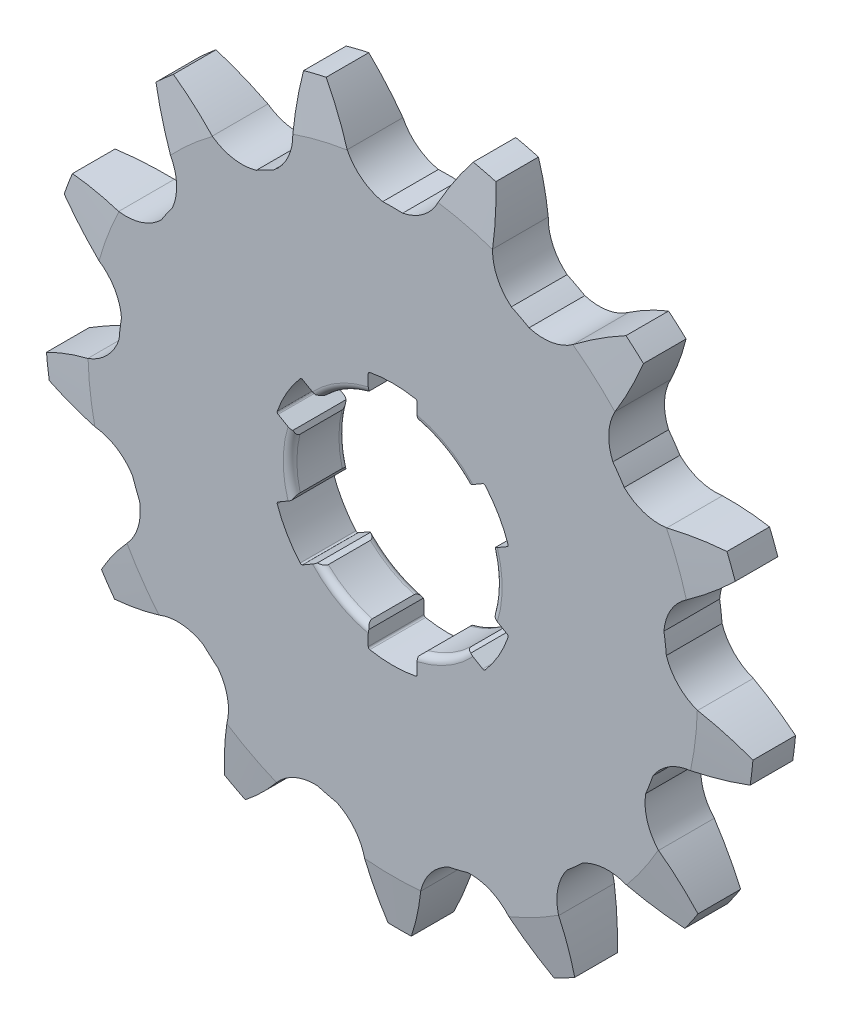
from build123d import *

# Parameters (mm, degrees)
DODANIE_WYCI_GNI_CIE1_DEPTH = 5.7
SZYK_KO_OWY1_COUNT          = 13
SZKIC4_OUTSIDE_W            = 602.69
SZKIC4_OUTSIDE_H            = 602.183
SZKIC4_OUTSIDE_R            = 31.1675
WYTNIJ_WYCI_GNI_CIE4_DEPTH  = 35.7
WYTNIJ_WYCI_GNI_CIE4_DRAFT  = -82
SZKIC5_OUTSIDE_W            = 513.272
SZKIC5_OUTSIDE_H            = 512.765
SZKIC5_OUTSIDE_R            = 31.1675
WYTNIJ_WYCI_GNI_CIE5_DEPTH  = 25.7
WYTNIJ_WYCI_GNI_CIE5_DRAFT  = -83
SZKIC10_R                   = 10.5
WYTNIJ_WYCI_GNI_CIE6_DEPTH  = 52.508093114
ZAOKR_GLENIE1_R             = 0.2
SFAZOWANIE1_SIZE            = 0.40919512
SFAZOWANIE1_SIZE_2          = 0.3
ZAOKR_GLENIE3_R             = 0.7


with BuildPart() as part:
    # Szkic1 → Dodanie-wyciągnięcie1 (new body)
    with BuildSketch(Plane.XY):
        with BuildLine():
            ThreePointArc((8.679500512, 35.214117834), (8.098931775, 35.352158748), (7.516170377, 35.480628614))
            ThreePointArc((7.516170377, 35.480628614), (5.979553034, 33.229042861), (4.65365868, 30.847271372))
            ThreePointArc((4.65365868, 30.847271372), (0, 27.9675), (-4.65365868, 30.847271372))
            ThreePointArc((-4.65365868, 30.847271372), (-5.979553034, 33.229042861), (-7.516170377, 35.480628614))
            ThreePointArc((-7.516170377, 35.480628614), (-8.098931775, 35.352158748), (-8.679500512, 35.214117834))
            Line((-8.679500512, 35.214117834), (-6.721778721, 27.271328297))
            ThreePointArc((-6.721778721, 27.271328297), (0, -28.0875), (6.721778721, 27.271328297))
            Line((6.721778721, 27.271328297), (8.679500512, 35.214117834))
        make_face()
    dodanie_wyci_gni_cie1 = extrude(amount=DODANIE_WYCI_GNI_CIE1_DEPTH)

    # Szyk kołowy1: Dodanie-wyciągnięcie1 ×13 about axis
    szyk_ko_owy1_axis = Axis((0, 0, 0), (0, 0, 1))
    for i in range(1, SZYK_KO_OWY1_COUNT):
        add(dodanie_wyci_gni_cie1.rotate(szyk_ko_owy1_axis, i * 360 / SZYK_KO_OWY1_COUNT))


with BuildPart() as wytnij_wyci_gni_cie4_tool:
    # Szkic4 outside → Wytnij-wyciągnięcie4 (with draft: the straight prism first)
    with BuildSketch(Plane.XY.offset(5.7)):
        with Locations((0, -0.3935)):
            Rectangle(SZKIC4_OUTSIDE_W, SZKIC4_OUTSIDE_H)
        Circle(SZKIC4_OUTSIDE_R, mode=Mode.SUBTRACT)
    extrude(amount=-WYTNIJ_WYCI_GNI_CIE4_DEPTH)
    # Wytnij-wyciągnięcie4: the draft: its side faces are tilted about the plane it starts from
    wytnij_wyci_gni_cie4_sides = [wytnij_wyci_gni_cie4_tool.faces().sort_by_distance(p)[0] for p in [
        (0, -301.485, -12.15),
        (301.345, -0.3935, -12.15),
        (0, 300.698, -12.15),
        (-301.345, -0.3935, -12.15),
        (-31.1675, 0, -12.15),
    ]]
    draft(wytnij_wyci_gni_cie4_sides, Plane.XY.offset(5.7), WYTNIJ_WYCI_GNI_CIE4_DRAFT)


with BuildPart() as part_1:
    add(part.part)

    # Wytnij-wyciągnięcie4: cut by wytnij_wyci_gni_cie4_tool
    add(wytnij_wyci_gni_cie4_tool.part, mode=Mode.SUBTRACT)


with BuildPart() as wytnij_wyci_gni_cie5_tool:
    # Szkic5 outside → Wytnij-wyciągnięcie5 (with draft: the straight prism first)
    with BuildSketch(Plane(origin=(0, 0, 0), x_dir=(-1, 0, 0), z_dir=(0, 0, -1))):
        with Locations((0, -0.3935)):
            Rectangle(SZKIC5_OUTSIDE_W, SZKIC5_OUTSIDE_H)
        Circle(SZKIC5_OUTSIDE_R, mode=Mode.SUBTRACT)
    extrude(amount=-WYTNIJ_WYCI_GNI_CIE5_DEPTH)
    # Wytnij-wyciągnięcie5: the draft: its side faces are tilted about the plane it starts from
    wytnij_wyci_gni_cie5_sides = [wytnij_wyci_gni_cie5_tool.faces().sort_by_distance(p)[0] for p in [
        (0, -256.776, 12.85),
        (-256.636, -0.3935, 12.85),
        (0, 255.989, 12.85),
        (256.636, -0.3935, 12.85),
        (31.1675, 0, 12.85),
    ]]
    draft(wytnij_wyci_gni_cie5_sides, Plane(origin=(0, 0, 0), x_dir=(-1, 0, 0), z_dir=(0, 0, -1)), WYTNIJ_WYCI_GNI_CIE5_DRAFT)


with BuildPart() as part_2:
    add(part_1.part)

    # Wytnij-wyciągnięcie5: cut by wytnij_wyci_gni_cie5_tool
    add(wytnij_wyci_gni_cie5_tool.part, mode=Mode.SUBTRACT)

    # Szkic10 → Wytnij-wyciągnięcie6 (cut, through all)
    with BuildSketch(Plane.XY.offset(5.7)):
        Circle(SZKIC10_R)
        with BuildLine():
            Line((-7.581760866, 7.264083023), (-9.356601718, 8.288787866))
            ThreePointArc((-9.356601718, 8.288787866), (-10.825317547, 6.25), (-11.856601718, 3.958660847))
            Line((-11.856601718, 3.958660847), (-10.081760866, 2.933956004))
            ThreePointArc((-10.081760866, 2.933956004), (-9.09326674, 5.25), (-7.581760866, 7.264083023))
        make_face()
        with BuildLine():
            Line((-10.081760866, -2.933956004), (-11.856601718, -3.958660847))
            ThreePointArc((-11.856601718, -3.958660847), (-10.825317547, -6.25), (-9.356601718, -8.288787866))
            Line((-9.356601718, -8.288787866), (-7.581760866, -7.264083023))
            ThreePointArc((-7.581760866, -7.264083023), (-9.09326674, -5.25), (-10.081760866, -2.933956004))
        make_face()
        with BuildLine():
            ThreePointArc((-2.5, -12.247448714), (0, -12.5), (2.5, -12.247448714))
            Line((2.5, -12.247448714), (2.5, -10.198039027))
            ThreePointArc((2.5, -10.198039027), (0, -10.5), (-2.5, -10.198039027))
            Line((-2.5, -10.198039027), (-2.5, -12.247448714))
        make_face()
        with BuildLine():
            ThreePointArc((9.356601718, -8.288787866), (10.825317547, -6.25), (11.856601718, -3.958660847))
            Line((11.856601718, -3.958660847), (10.081760866, -2.933956004))
            ThreePointArc((10.081760866, -2.933956004), (9.09326674, -5.25), (7.581760866, -7.264083023))
            Line((7.581760866, -7.264083023), (9.356601718, -8.288787866))
        make_face()
        with BuildLine():
            ThreePointArc((11.856601718, 3.958660847), (10.825317547, 6.25), (9.356601718, 8.288787866))
            Line((9.356601718, 8.288787866), (7.581760866, 7.264083023))
            ThreePointArc((7.581760866, 7.264083023), (9.09326674, 5.25), (10.081760866, 2.933956004))
            Line((10.081760866, 2.933956004), (11.856601718, 3.958660847))
        make_face()
        with BuildLine():
            Line((2.5, 10.198039027), (2.5, 12.247448714))
            ThreePointArc((2.5, 12.247448714), (0, 12.5), (-2.5, 12.247448714))
            Line((-2.5, 12.247448714), (-2.5, 10.198039027))
            ThreePointArc((-2.5, 10.198039027), (0, 10.5), (2.5, 10.198039027))
        make_face()
    extrude(amount=-WYTNIJ_WYCI_GNI_CIE6_DEPTH, mode=Mode.SUBTRACT)

    # Zaokrąglenie1
    zaokr_glenie1_edges = [part_2.edges().sort_by_distance(p)[0] for p in [
        (11.856601718, -3.958660847, 2.85),
        (9.356601718, -8.288787866, 2.85),
        (2.5, -12.247448714, 2.85),
        (-2.5, -12.247448714, 2.85),
        (-9.356601718, -8.288787866, 2.85),
        (-11.856601718, -3.958660847, 2.85),
        (-11.856601718, 3.958660847, 2.85),
        (-9.356601718, 8.288787866, 2.85),
        (-2.5, 12.247448714, 2.85),
        (2.5, 12.247448714, 2.85),
        (9.356601718, 8.288787866, 2.85),
        (11.856601718, 3.958660847, 2.85),
    ]]
    fillet(zaokr_glenie1_edges, radius=ZAOKR_GLENIE1_R)

    # Sfazowanie1
    # the kernel refuses this chamfer: 0.40919512, 0.3 mm, written as the material it takes off along each edge
    with BuildSketch(Plane(origin=(10.081760866, 2.933956004, 6.758191967), x_dir=(0.8660254037844966, 0.4999999999998995, 0), z_dir=(0, 0, -1)), Plane(origin=(-7.581760866, 7.264083023, 6.758191967), x_dir=(-0.866025403784549, 0.4999999999998089, 0), z_dir=(0, 0, -1)), Plane(origin=(2.5, 10.198039027, 6.758191967), x_dir=(0, 1, 0), z_dir=(0, 0, -1))) as sfazowanie1_piece_1:
        with BuildLine():
            Line((SFAZOWANIE1_SIZE * 0.999999998891, 0), (-0.076766192, 0.294608414))
            ThreePointArc((-0.076766192, 0.294608414), (-0.038797994, 0.153266221), (0, 0))
            Line((0, 0), (SFAZOWANIE1_SIZE * 0.999999998891, 0))
        make_face()
    extrude(amount=7.816383934, mode=Mode.SUBTRACT)
    with BuildSketch(Plane(origin=(10.081760866, -2.933956004, 6.794003353), x_dir=(0.26001062801757335, 0.9656057546006586, 0), z_dir=(0, 0, -1)), Plane(origin=(-2.5, 10.198039027, 6.794003353), x_dir=(-0.9662444275336357, -0.257627068182279, 0), z_dir=(0, 0, -1)), Plane(origin=(7.581760866, 7.264083023, 6.794003353), x_dir=(-0.7062337995157678, 0.7079786864175519, 0), z_dir=(0, 0, -1))) as sfazowanie1_piece_2:
        with BuildLine():
            Line((0.423359654, 0), (-SFAZOWANIE1_SIZE_2 * 0.257627068183, SFAZOWANIE1_SIZE_2 * 0.966244427533))
            Line((-SFAZOWANIE1_SIZE_2 * 0.257627068183, SFAZOWANIE1_SIZE_2 * 0.966244427533), (0, 0))
            ThreePointArc((0, 0), (0.218766446, 0.002131556), (0.423359654, 0))
        make_face()
    extrude(amount=7.888006705, mode=Mode.SUBTRACT)
    with BuildSketch(Plane(origin=(7.581760866, -7.264083023, 6.758191967), x_dir=(-0.702212908193915, -0.7119670157850321, 0), z_dir=(0, 0, -1)), Plane(origin=(-2.5, -10.198039027, 6.758191967), x_dir=(-0.9676879764237046, 0.25215070946756385, 0), z_dir=(0, 0, -1)), Plane(origin=(-10.081760866, -2.933956004, 6.758191967), x_dir=(-0.26547506823126754, 0.9641177252533032, 0), z_dir=(0, 0, -1))) as sfazowanie1_piece_3:
        with BuildLine():
            Line((0.30444567, 0), (-SFAZOWANIE1_SIZE * 0.252150709189, -SFAZOWANIE1_SIZE * 0.96768797535))
            Line((-SFAZOWANIE1_SIZE * 0.252150709189, -SFAZOWANIE1_SIZE * 0.96768797535), (0, 0))
            ThreePointArc((0, 0), (0.158096821, -0.001101834), (0.30444567, 0))
        make_face()
    extrude(amount=7.816383934, mode=Mode.SUBTRACT)
    with BuildSketch(Plane(origin=(2.5, -10.198039027, 6.794003353), x_dir=(0, -1, 0), z_dir=(0, 0, -1)), Plane(origin=(-7.581760866, -7.264083023, 6.794003353), x_dir=(-0.8660254037845618, -0.49999999999978667, 0), z_dir=(0, 0, -1)), Plane(origin=(-10.081760866, 2.933956004, 6.794003353), x_dir=(-0.866025403784313, 0.5000000000002178, 0), z_dir=(0, 0, -1))) as sfazowanie1_piece_4:
        with BuildLine():
            Line((SFAZOWANIE1_SIZE_2, 0), (-0.109068906, -0.409068906))
            ThreePointArc((-0.109068906, -0.409068906), (-0.054300554, -0.211931006), (0, 0))
            Line((0, 0), (SFAZOWANIE1_SIZE_2, 0))
        make_face()
    extrude(amount=7.888006705, mode=Mode.SUBTRACT)

    # Zaokrąglenie3
    zaokr_glenie3_edges = [part_2.edges().sort_by_distance(p)[0] for p in [
        (10.49983161, 0.059465683, 0),
        (5.198417013, 9.122853751, 0),
        (-10.49983161, -0.059465683, 0),
        (-5.198417013, -9.122853751, 0),
        (5.301414597, -9.063388068, 0),
        (-5.301414597, 9.063388068, 0),
        (-10.49983161, -0.059465683, 5.7),
        (-5.198417013, -9.122853751, 5.7),
        (-5.301414597, 9.063388068, 5.7),
        (5.198417013, 9.122853751, 5.7),
        (10.49983161, 0.059465683, 5.7),
        (5.301414597, -9.063388068, 5.7),
    ]]
    fillet(zaokr_glenie3_edges, radius=ZAOKR_GLENIE3_R)


solid = part_2.part
